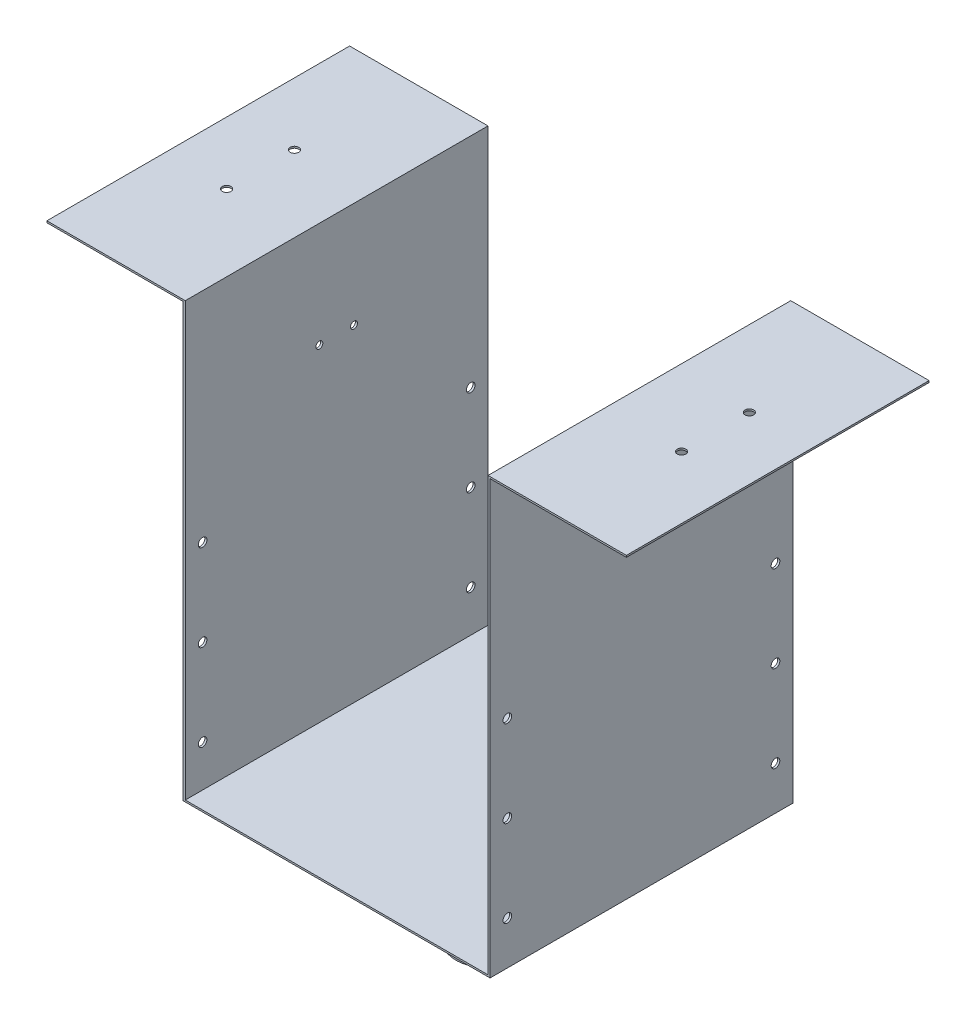
from build123d import *

# Parameters (mm, degrees)
SKETCH1_W           = 175
SKETCH1_H           = 175
BOSS_EXTRUDE1_DEPTH = 1
SKETCH2_W           = 1.2
SKETCH2_H           = 175
BOSS_EXTRUDE2_DEPTH = 250
SKETCH3_W           = 80
SKETCH3_H           = 175
BOSS_EXTRUDE3_DEPTH = 1
SKETCH4_R           = 2.5
CUT_EXTRUDE1_DEPTH  = 10
SKETCH6_R           = 2.5
SKETCH6_R_2         = 2
CUT_EXTRUDE2_DEPTH  = 300
SKETCH7_R           = 18.5
SKETCH7_R_2         = 12.5
BOSS_EXTRUDE4_DEPTH = 70


with BuildPart() as part:
    # Sketch1 → Boss-Extrude1 (new body)
    with BuildSketch(Plane(origin=(0, 0, 0), x_dir=(1, 0, 0), z_dir=(0, 1, 0))):
        Rectangle(SKETCH1_W, SKETCH1_H)
    extrude(amount=BOSS_EXTRUDE1_DEPTH)

    # Sketch2 → Boss-Extrude2 (add)
    with BuildSketch(Plane.XZ):
        with Locations((-88.1, 0)):
            Rectangle(SKETCH2_W, SKETCH2_H)
        with Locations((88.1, 0)):
            Rectangle(SKETCH2_W, SKETCH2_H)
    extrude(amount=-BOSS_EXTRUDE2_DEPTH)

    # Sketch3 → Boss-Extrude3 (add)
    with BuildSketch(Plane(origin=(0, 250, 0), x_dir=(1, 0, 0), z_dir=(0, 1, 0))):
        with Locations((-127.5, 0)):
            Rectangle(SKETCH3_W, SKETCH3_H)
        with Locations((127.5, 0)):
            Rectangle(SKETCH3_W, SKETCH3_H)
    extrude(amount=BOSS_EXTRUDE3_DEPTH)

    # Sketch4 → Cut-Extrude1 (cut)
    with BuildSketch(Plane(origin=(0, 251, 0), x_dir=(1, 0, 0), z_dir=(0, 1, 0))):
        with Locations((131.5, 19.6)):
            Circle(SKETCH4_R)
        with Locations((131.5, -19.6)):
            Circle(SKETCH4_R)
        with Locations((-131.5, -19.6)):
            Circle(SKETCH4_R)
        with Locations((-131.5, 19.6)):
            Circle(SKETCH4_R)
    extrude(amount=-CUT_EXTRUDE1_DEPTH, mode=Mode.SUBTRACT)

    # Sketch6 → Cut-Extrude2 (cut)
    with BuildSketch(Plane(origin=(88.7, 0, 0), x_dir=(0, 0, -1), z_dir=(1, 0, 0))):
        with Locations((77.5, 25)):
            Circle(SKETCH6_R)
        with Locations((77.5, 75)):
            Circle(SKETCH6_R)
        with Locations((77.5, 125)):
            Circle(SKETCH6_R)
        with Locations((-77.5, 125)):
            Circle(SKETCH6_R)
        with Locations((-77.5, 75)):
            Circle(SKETCH6_R)
        with Locations((-77.5, 25)):
            Circle(SKETCH6_R)
        with Locations((-10, 190)):
            Circle(SKETCH6_R_2)
        with Locations((10, 190)):
            Circle(SKETCH6_R_2)
    extrude(amount=-CUT_EXTRUDE2_DEPTH, mode=Mode.SUBTRACT)

    # Sketch7 → Boss-Extrude4 (add)
    with BuildSketch(Plane.XZ):
        Circle(SKETCH7_R)
        Circle(SKETCH7_R_2, mode=Mode.SUBTRACT)
    extrude(amount=BOSS_EXTRUDE4_DEPTH)


solid = part.part
